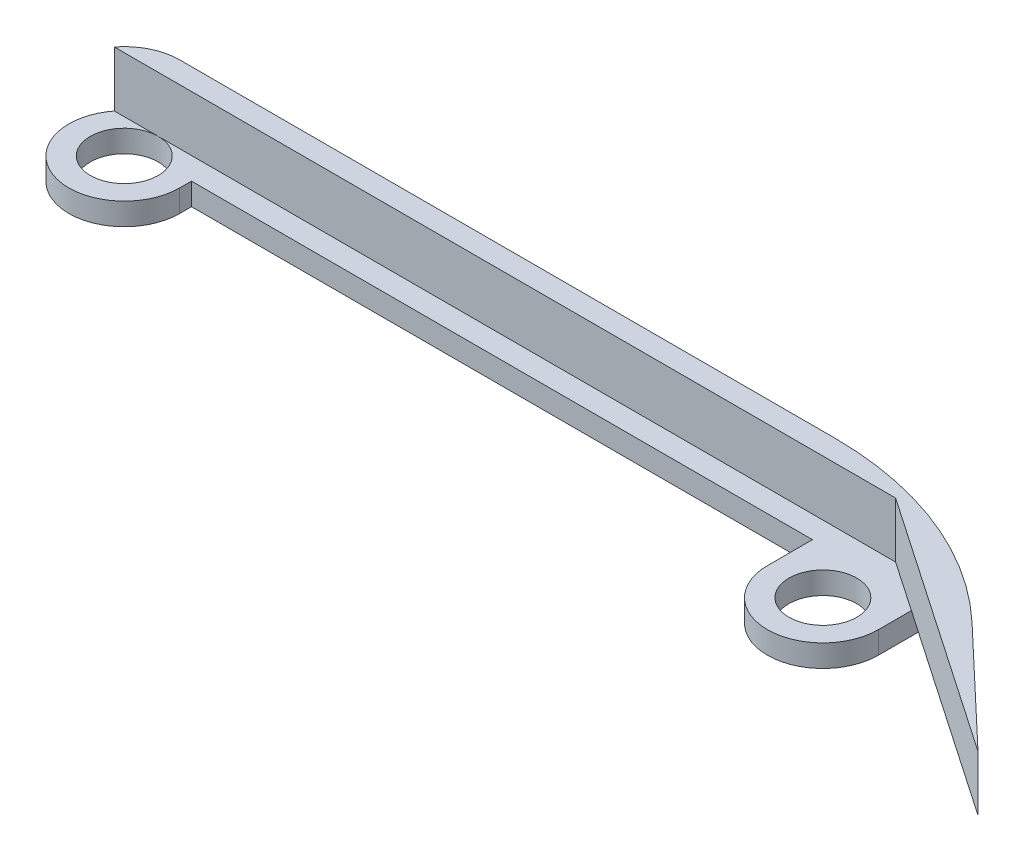
from build123d import *

# Parameters (mm, degrees)
SKETCH1_R           = 3.06
BOSS_EXTRUDE1_DEPTH = 2
BOSS_EXTRUDE2_START = -2
BOSS_EXTRUDE2_DEPTH = 5
SKETCH6_W           = 56
SKETCH6_H           = 2
BOSS_EXTRUDE3_DEPTH = 2
FILLET1_R           = 30
FILLET2_R           = 5


with BuildPart() as part:
    # Sketch1 → Boss-Extrude1 (new body)
    with BuildSketch(Plane(origin=(0, 0, 0), x_dir=(1, 0, 0), z_dir=(0, 1, 0))):
        with BuildLine():
            Line((-5, 0), (-5, 5))
            Line((-5, 5), (71, 5))
            Line((71, 5), (71, -3))
            ThreePointArc((71, -3), (66, -8), (61, -3))
            Line((61, -3), (61, 3.06))
            Line((61, 3.06), (5, 3.06))
            Line((5, 3.06), (5, 0))
            ThreePointArc((5, 0), (0, -5), (-5, 0))
        make_face()
        with Locations(Location((0, 0, 0), (0, 0, 270))):
            Circle(SKETCH1_R, mode=Mode.SUBTRACT)
        with Locations(Location((66, -3, 0), (0, 0, 270))):
            Circle(SKETCH1_R, mode=Mode.SUBTRACT)
    extrude(amount=BOSS_EXTRUDE1_DEPTH)

    # Sketch4 → Boss-Extrude2 (add)
    with BuildSketch(Plane(origin=(0, 0, 0), x_dir=(-1, 0, 0), z_dir=(0, -1, 0)).offset(BOSS_EXTRUDE2_START)):
        Polygon((5, 5), (-71, 5), (-90, -13.010835443), (-66.5, 3.06), (5, 3.06), align=None)
    extrude(amount=-BOSS_EXTRUDE2_DEPTH)

    # Sketch6 → Boss-Extrude3 (add)
    with BuildSketch(Plane(origin=(0, 0, 0), x_dir=(-1, 0, 0), z_dir=(0, -1, 0))):
        with Locations((-33, 2.06)):
            Rectangle(SKETCH6_W, SKETCH6_H)
    extrude(amount=-BOSS_EXTRUDE3_DEPTH)

    # Fillet1
    # the kernel refuses this fillet: 30 mm, written as the material it takes off along each edge
    with BuildSketch(Plane(origin=(71, -27.8984931, -5), x_dir=(0.7257460116750271, 0, 0.6879627363002968), z_dir=(0, 1, 0))) as fillet1_piece_1:
        with BuildLine():
            CenterArc((FILLET1_R * 0.398646574667, -FILLET1_R), FILLET1_R, 90, 43.469057367)
            Line((-FILLET1_R * 0.289316161633, -FILLET1_R * 0.274253988325), (0, 0))
            Line((0, 0), (FILLET1_R * 0.398646574667, 0))
        make_face()
    extrude(amount=64.7969862, mode=Mode.SUBTRACT)

    # Fillet2
    # the kernel refuses this fillet: 5 mm, written as the material it takes off along each edge
    with BuildSketch(Plane(origin=(-5, 19.5, -5), x_dir=(0, 0, 1), z_dir=(0, -1, 0))) as fillet2_piece_1:
        with BuildLine():
            CenterArc((FILLET2_R, -FILLET2_R), FILLET2_R, 90, 90)
            Line((0, -FILLET2_R), (0, 0))
            Line((0, 0), (FILLET2_R, 0))
        make_face()
    extrude(amount=32, mode=Mode.SUBTRACT)


solid = part.part
